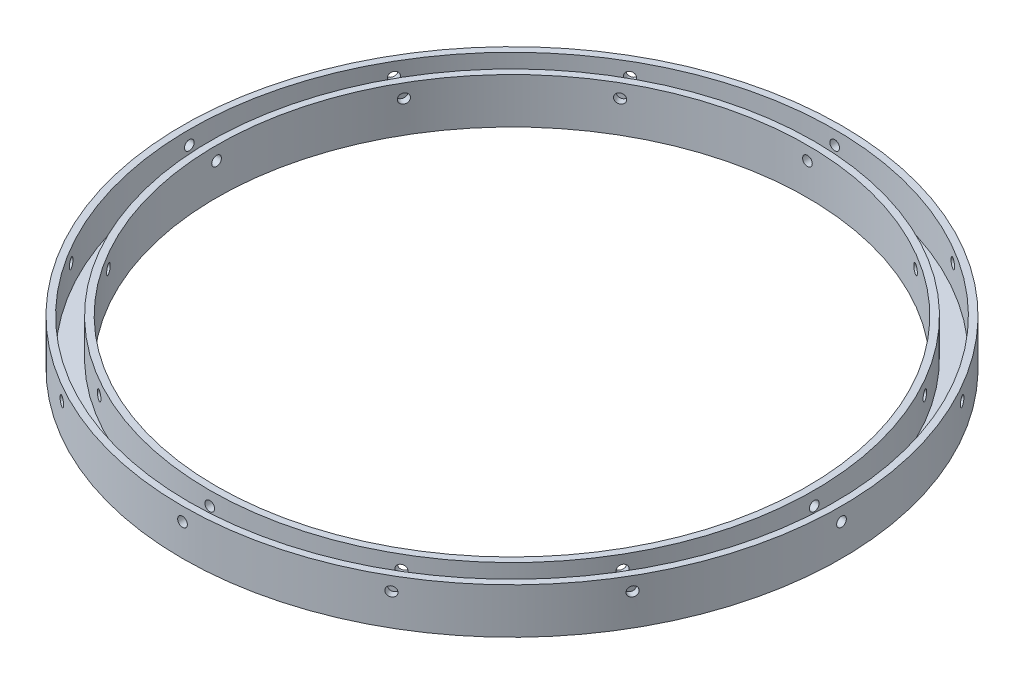
from build123d import *

# Parameters (mm, degrees)
SKETCH1_R               = 92.075
SKETCH1_R_2             = 82.55
BOSS_EXTRUDE1_DEPTH     = 12.7
SKETCH2_R               = 90.17
SKETCH2_R_2             = 84.455
CUT_EXTRUDE1_DEPTH      = 10.16
CUT_EXTRUDE2_REACH      = 132.832
CUT_EXTRUDE2_END_RADIUS = 92.075
SKETCH3_R               = 1.35255
CIRPATTERN1_COUNT       = 12


with BuildPart() as part:
    # Sketch1 → Boss-Extrude1 (new body)
    with BuildSketch(Plane(origin=(0, 0, 0), x_dir=(1, 0, 0), z_dir=(0, 1, 0))):
        Circle(SKETCH1_R)
        Circle(SKETCH1_R_2, mode=Mode.SUBTRACT)
    extrude(amount=BOSS_EXTRUDE1_DEPTH)

    # Sketch2 → Cut-Extrude1 (cut)
    with BuildSketch(Plane(origin=(0, 12.7, 0), x_dir=(1, 0, 0), z_dir=(0, 1, 0))):
        Circle(SKETCH2_R)
        Circle(SKETCH2_R_2, mode=Mode.SUBTRACT)
    extrude(amount=-CUT_EXTRUDE1_DEPTH, mode=Mode.SUBTRACT)

    # Cut-Extrude2: up to this cylinder (the profile starts inside it)
    cut_extrude2_end = Plane(origin=(0, 8.89, 0), z_dir=(0, -1, 0)) * Cylinder(CUT_EXTRUDE2_END_RADIUS, 450.814, mode=Mode.PRIVATE)
    # Sketch3 → Cut-Extrude2 (cut, up to the surface)
    with BuildSketch(Plane.XY, mode=Mode.PRIVATE) as cut_extrude2_sk1:
        with Locations((0, 8.89)):
            Circle(SKETCH3_R)
    cut_extrude2_tool1 = extrude(cut_extrude2_sk1.sketch, amount=-CUT_EXTRUDE2_REACH, mode=Mode.PRIVATE) & cut_extrude2_end
    cut_extrude2 = cut_extrude2_tool1.solids().sort_by_distance((0, 8.89, 0))[0]
    add(cut_extrude2, mode=Mode.SUBTRACT)

    # CirPattern1: Cut-Extrude2 ×12 about axis
    cirpattern1_axis = Axis((0, 12.7, 0), (0, 1, 0))
    for i in range(1, CIRPATTERN1_COUNT):
        add(cut_extrude2.rotate(cirpattern1_axis, i * 360 / CIRPATTERN1_COUNT), mode=Mode.SUBTRACT)


solid = part.part
